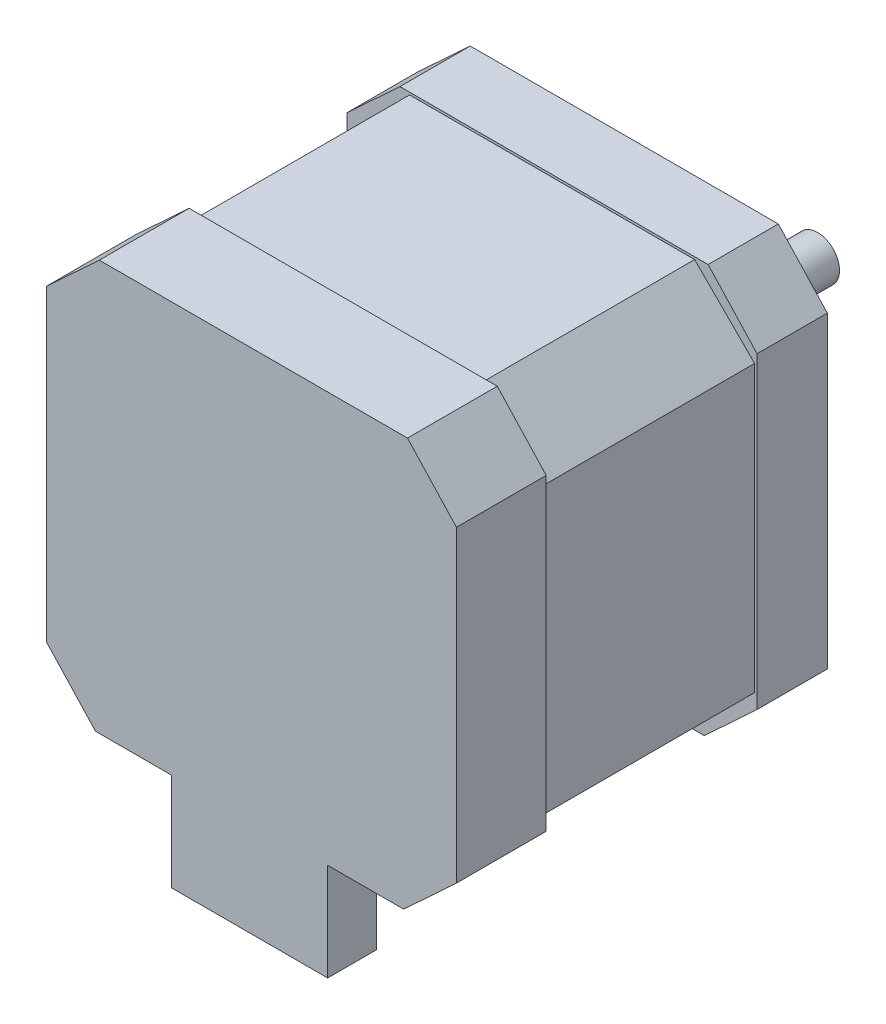
from build123d import *

# Parameters (mm, degrees)
RESSALTO_EXTRUS_O1_DEPTH   = 38
CORTE_EXTRUS_O_FINA1_START = -30.8
CORTE_EXTRUS_O_FINA1_DEPTH = 21.6
ESBO_O3_R                  = 2.25
RESSALTO_EXTRUS_O2_DEPTH   = 20
ESBO_O4_R                  = 10
RESSALTO_EXTRUS_O3_DEPTH   = 2
ESBO_O5_R                  = 1.5
CORTE_EXTRUS_O1_DEPTH      = 10
ESBO_O7_W                  = 16
ESBO_O7_H                  = 5
RESSALTO_EXTRUS_O4_DEPTH   = 10


# Read off the part's stored shape, not the designer's step: Corte-Extrusão-Fina1
with BuildPart() as part:
    # Esboço1 → Ressalto-extrusão1 (new body)
    with BuildSketch(Plane.XY):
        Polygon((-21, -15.592171873), (-15.984175996, -21), (15.592171873, -21), (21, -15.984175996), (21, 15.592171873), (15.984175996, 21), (-15.592171873, 21), (-21, 15.984175996), align=None)
    extrude(amount=RESSALTO_EXTRUS_O1_DEPTH)

    # Corte-Extrusão-Fina1 outline → Corte-Extrusão-Fina1 (cut)
    with BuildSketch(Plane.XY.offset(38).offset(CORTE_EXTRUS_O_FINA1_START)):
        Polygon((15.592171873, -21), (21, -15.984175996), (21, 15.592171873), (15.984175996, 21), (-15.592171873, 21), (-21, 15.984175996), (-21, -15.592171873), (-15.984175996, -21), align=None)
        Polygon((14.605339059, 20.75), (20.75, 14.605339059), (20.75, -14.605339059), (14.605339059, -20.75), (-14.605339059, -20.75), (-20.75, -14.605339059), (-20.75, 14.605339059), (-14.605339059, 20.75), align=None, mode=Mode.SUBTRACT)
    extrude(amount=CORTE_EXTRUS_O_FINA1_DEPTH, mode=Mode.SUBTRACT)

    # Esboço3 → Ressalto-extrusão2 (add)
    with BuildSketch(Plane(origin=(0, 0, 0), x_dir=(-1, 0, 0), z_dir=(0, 0, -1))):
        with Locations(Location((0, 0, 0), (0, 0, 180))):
            Circle(ESBO_O3_R)
    extrude(amount=RESSALTO_EXTRUS_O2_DEPTH)

    # Esboço4 → Ressalto-extrusão3 (add)
    with BuildSketch(Plane(origin=(0, 0, 0), x_dir=(-1, 0, 0), z_dir=(0, 0, -1))):
        with Locations(Location((0, 0, 0), (0, 0, 180))):
            Circle(ESBO_O4_R)
    extrude(amount=RESSALTO_EXTRUS_O3_DEPTH)

    # Esboço5 → Corte-extrusão1 (cut)
    with BuildSketch(Plane(origin=(0, 0, 0), x_dir=(-1, 0, 0), z_dir=(0, 0, -1))):
        with Locations((15.5, -15.5)):
            Circle(ESBO_O5_R)
        with Locations((-15.5, -15.5)):
            Circle(ESBO_O5_R)
        with Locations((-15.5, 15.5)):
            Circle(ESBO_O5_R)
        with Locations((15.5, 15.5)):
            Circle(ESBO_O5_R)
    extrude(amount=-CORTE_EXTRUS_O1_DEPTH, mode=Mode.SUBTRACT)

    # Esboço7 → Ressalto-extrusão4 (add)
    with BuildSketch(Plane.XZ.offset(21)):
        with Locations((-0.196002062, 35.5)):
            Rectangle(ESBO_O7_W, ESBO_O7_H)
    extrude(amount=RESSALTO_EXTRUS_O4_DEPTH)


solid = part.part
